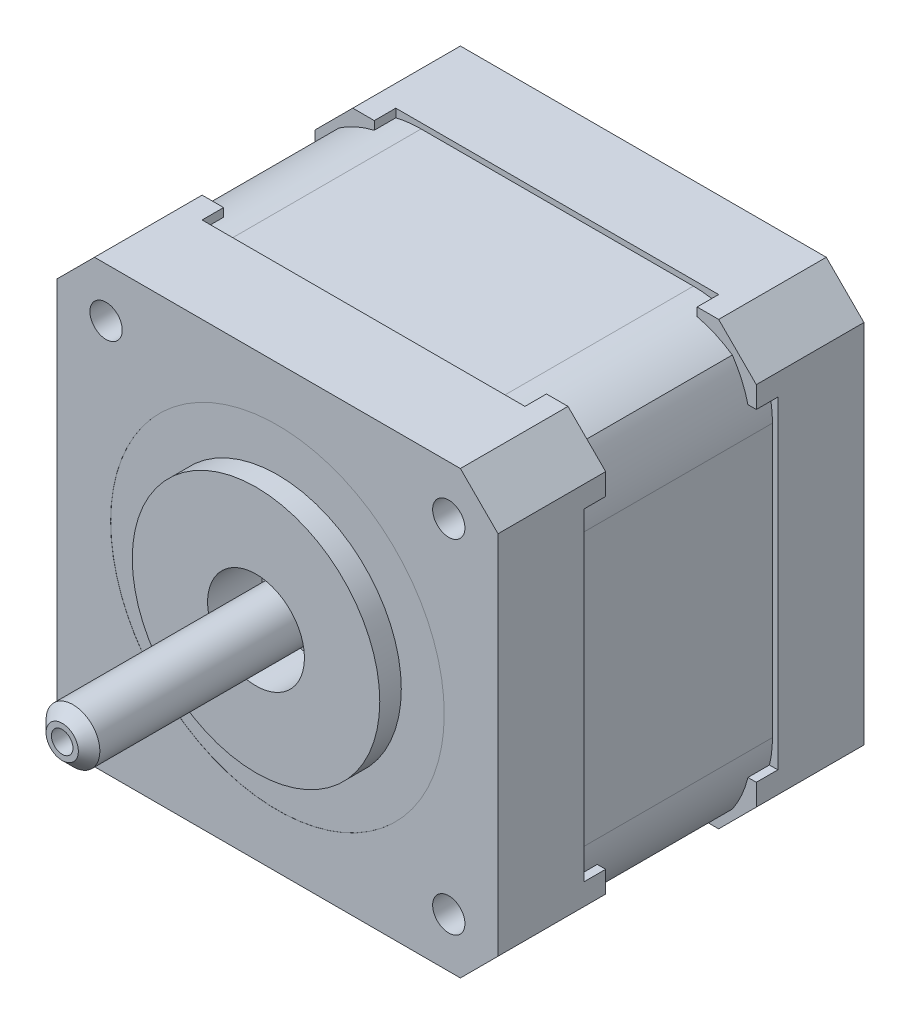
from build123d import *

# Parameters (mm, degrees)
Y_KSEKLIK_EKSTR_ZYON2_DEPTH  = 8
Y_KSEKLIK_EKSTR_ZYON10_DEPTH = 2
Y_KSEKLIK_EKSTR_ZYON11_DEPTH = 18
Y_KSEKLIK_EKSTR_ZYON12_DEPTH = 8
Y_KSEKLIK_EKSTR_ZYON14_DEPTH = 2
RADYUS5_R                    = 10
IZIM15_R                     = 4.5
KES_EKSTR_ZYON3_DEPTH        = 3
RADYUS6_R                    = 0.5
IZIM16_R                     = 3
Y_KSEKLIK_EKSTR_ZYON15_DEPTH = 1
RADYUS7_R                    = 0.5
KES_EKSTR_ZYON4_DEPTH        = 0.5
IZIM18_R                     = 3
KES_EKSTR_ZYON5_DEPTH        = 1
IZIM19_R                     = 2
Y_KSEKLIK_EKSTR_ZYON17_DEPTH = 0.5
RADYUS8_R                    = 0.5
KES_EKSTR_ZYON6_DEPTH        = 0.1
KES_EKSTR_ZYON7_START        = -3
IZIM22_R                     = 4.5
KES_EKSTR_ZYON7_DEPTH        = 3
IZIM23_R                     = 2.5
Y_KSEKLIK_EKSTR_ZYON18_DEPTH = 23
IZIM24_R                     = 1
KES_EKSTR_ZYON8_DEPTH        = 2
PAH1_SIZE                    = 1
KES_EKSTR_ZYON9_START        = -0.01
IZIM25_R                     = 15.5
IZIM25_R_2                   = 4.5
KES_EKSTR_ZYON9_DEPTH        = 0.01
IZIM26_R                     = 11.5
IZIM26_R_2                   = 4.5
Y_KSEKLIK_EKSTR_ZYON19_DEPTH = 2
IZIM28_R                     = 1.5
KES_EKSTR_ZYON10_DEPTH       = 6


# Some blends are built 0.0001 mm under size
with BuildPart() as part:
    # Çizim1 → Yükseklik-Ekstrüzyon2 (new body)
    with BuildSketch(Plane.XY):
        Polygon((-17, 41), (17, 41), (20.5, 37.5), (20.5, 3.5), (17, 0), (-17, 0), (-20.5, 3.5), (-20.5, 37.5), align=None)
    extrude(amount=Y_KSEKLIK_EKSTR_ZYON2_DEPTH)

    # Çizim5 → Yükseklik-Ekstrüzyon10 (add)
    with BuildSketch(Plane(origin=(0, 0, 0), x_dir=(-1, 0, 0), z_dir=(0, 0, -1))):
        Polygon((-20.5, 37.5), (-20.5, 35.5), (-20, 35.5), (-20, 37.292893219), (-16.792893219, 40.5), (-15, 40.5), (-15, 41), (-17, 41), align=None)
        Polygon((17, 41), (15, 41), (15, 40.5), (16.792893219, 40.5), (20, 37.292893219), (20, 35.5), (20.5, 35.5), (20.5, 37.5), align=None)
        Polygon((15, 0.5), (15, 0), (17, 0), (20.5, 3.5), (20.5, 5.5), (20, 5.5), (20, 3.707106781), (16.792893219, 0.5), align=None)
        Polygon((-20.5, 5.5), (-20.5, 3.5), (-17, 0), (-15, 0), (-15, 0.5), (-16.792893219, 0.5), (-20, 3.707106781), (-20, 5.5), align=None)
    extrude(amount=Y_KSEKLIK_EKSTR_ZYON10_DEPTH)

    # Çizim12 → Yükseklik-Ekstrüzyon11 (add)
    with BuildSketch(Plane(origin=(0, 0, 0), x_dir=(-1, 0, 0), z_dir=(0, 0, -1))):
        Polygon((-20, 37.292893219), (-20, 35.5), (-20, 5.5), (-20, 3.707106781), (-16.792893219, 0.5), (-15, 0.5), (15, 0.5), (16.792893219, 0.5), (20, 3.707106781), (20, 5.5), (20, 35.5), (20, 37.292893219), (16.792893219, 40.5), (15, 40.5), (-15, 40.5), (-16.792893219, 40.5), align=None)
    extrude(amount=Y_KSEKLIK_EKSTR_ZYON11_DEPTH)

    # Çizim13 → Yükseklik-Ekstrüzyon12 (add)
    with BuildSketch(Plane(origin=(0, 0, -18), x_dir=(-1, 0, 0), z_dir=(0, 0, -1))):
        Polygon((-17, 41), (-20.5, 37.5), (-20.5, 3.5), (-17, 0), (17, 0), (20.5, 3.5), (20.5, 37.5), (17, 41), align=None)
    extrude(amount=Y_KSEKLIK_EKSTR_ZYON12_DEPTH)

    # Çizim14 → Yükseklik-Ekstrüzyon14 (add)
    with BuildSketch(Plane.XY.offset(-18)):
        Polygon((-15, 40.5), (-15, 41), (-17, 41), (-20.5, 37.5), (-20.5, 35.5), (-20, 35.5), (-20, 37.292893219), (-16.792893219, 40.5), align=None)
        Polygon((-20, 5.5), (-20.5, 5.5), (-20.5, 3.5), (-17, 0), (-15, 0), (-15, 0.5), (-16.792893219, 0.5), (-20, 3.707106781), align=None)
        Polygon((20.5, 3.5), (20.5, 5.5), (20, 5.5), (20, 3.707106781), (16.792893219, 0.5), (15, 0.5), (15, 0), (17, 0), align=None)
        Polygon((20.5, 37.5), (17, 41), (15, 41), (15, 40.5), (16.792893219, 40.5), (20, 37.292893219), (20, 35.5), (20.5, 35.5), align=None)
    extrude(amount=Y_KSEKLIK_EKSTR_ZYON14_DEPTH)

    # Radyus5
    # the kernel refuses this fillet: 10 mm, written as the material it takes off along each edge
    with BuildSketch(Plane(origin=(-20, 3.707106781, 8.355339059), x_dir=(0, 1, 0), z_dir=(0, 0, -1))) as radyus5_piece_1_section:
        with BuildLine():
            CenterArc((RADYUS5_R * 0.414213562373, RADYUS5_R), RADYUS5_R, 225, 45)
            Line((-RADYUS5_R * 0.292893218813, RADYUS5_R * 0.292893218813), (0, 0))
            Line((0, 0), (RADYUS5_R * 0.414213562373, 0))
        make_face()
    radyus5_piece_1 = extrude(amount=24.355339059, mode=Mode.PRIVATE)
    radyus5_piece_1 = split(radyus5_piece_1, bisect_by=Plane(origin=(-20.041778626, 6.488010165, -2), z_dir=(0, 0, 1)), keep=Keep.TOP, mode=Mode.PRIVATE)
    radyus5_piece_1 = split(radyus5_piece_1, bisect_by=Plane(origin=(-20.041778626, 5.5, -1), z_dir=(0, 1, 0)), keep=Keep.TOP, mode=Mode.PRIVATE)
    radyus5_piece_1 = split(radyus5_piece_1, bisect_by=Plane(origin=(-20.041778626, 6.488010165, 0), z_dir=(0, 0, -1)), keep=Keep.TOP, mode=Mode.PRIVATE)
    add(radyus5_piece_1, mode=Mode.SUBTRACT)
    with BuildSketch(Plane(origin=(-20, 3.707106781, -2), x_dir=(0, 1, 0), z_dir=(0, 0, -1))) as radyus5_piece_2_section:
        with BuildLine():
            CenterArc((RADYUS5_R * 0.414213562373, RADYUS5_R), RADYUS5_R, 225, 45)
            Line((-RADYUS5_R * 0.292893218813, RADYUS5_R * 0.292893218813), (0, 0))
            Line((0, 0), (RADYUS5_R * 0.414213562373, 0))
        make_face()
    radyus5_piece_2 = extrude(amount=14, mode=Mode.PRIVATE)
    radyus5_piece_2 = split(radyus5_piece_2, bisect_by=Plane(origin=(-20.041778626, 5.5, -9), z_dir=(0, 1, 0)), keep=Keep.TOP, mode=Mode.PRIVATE)
    add(radyus5_piece_2, mode=Mode.SUBTRACT)
    with BuildSketch(Plane(origin=(-20, 3.707106781, -2), x_dir=(0, 1, 0), z_dir=(0, 0, -1))) as radyus5_piece_3_section:
        with BuildLine():
            CenterArc((RADYUS5_R * 0.414213562373, RADYUS5_R), RADYUS5_R, 225, 45)
            Line((-RADYUS5_R * 0.292893218813, RADYUS5_R * 0.292893218813), (0, 0))
            Line((0, 0), (RADYUS5_R * 0.414213562373, 0))
        make_face()
    radyus5_piece_3 = extrude(amount=14, mode=Mode.PRIVATE)
    radyus5_piece_3 = split(radyus5_piece_3, bisect_by=Plane(origin=(-19.237230112, 5.5, -9), z_dir=(0, -1, 0)), keep=Keep.TOP, mode=Mode.PRIVATE)
    add(radyus5_piece_3, mode=Mode.SUBTRACT)
    with BuildSketch(Plane(origin=(-20, 3.707106781, -2), x_dir=(0, 1, 0), z_dir=(0, 0, -1))) as radyus5_piece_4_section:
        with BuildLine():
            CenterArc((RADYUS5_R * 0.414213562373, RADYUS5_R), RADYUS5_R, 225, 45)
            Line((-RADYUS5_R * 0.292893218813, RADYUS5_R * 0.292893218813), (0, 0))
            Line((0, 0), (RADYUS5_R * 0.414213562373, 0))
        make_face()
    radyus5_piece_4 = extrude(amount=24.355339059, mode=Mode.PRIVATE)
    radyus5_piece_4 = split(radyus5_piece_4, bisect_by=Plane(origin=(-20.041778626, 6.488010165, -16), z_dir=(0, 0, -1)), keep=Keep.TOP, mode=Mode.PRIVATE)
    radyus5_piece_4 = split(radyus5_piece_4, bisect_by=Plane(origin=(-20.041778626, 6.488010165, -18), z_dir=(0, 0, 1)), keep=Keep.TOP, mode=Mode.PRIVATE)
    radyus5_piece_4 = split(radyus5_piece_4, bisect_by=Plane(origin=(-20.041778626, 5.5, -17), z_dir=(0, 1, 0)), keep=Keep.TOP, mode=Mode.PRIVATE)
    add(radyus5_piece_4, mode=Mode.SUBTRACT)
    with BuildSketch(Plane(origin=(-16.792893219, 0.5, 8.355339059), x_dir=(-0.7071067811865476, 0.7071067811865476, 0), z_dir=(0, 0, -1))) as radyus5_piece_5_section:
        with BuildLine():
            CenterArc((RADYUS5_R * 0.414213562373, RADYUS5_R), RADYUS5_R, 225, 45)
            Line((-RADYUS5_R * 0.292893218813, RADYUS5_R * 0.292893218813), (0, 0))
            Line((0, 0), (RADYUS5_R * 0.414213562373, 0))
        make_face()
    radyus5_piece_5 = extrude(amount=24.355339059, mode=Mode.PRIVATE)
    radyus5_piece_5 = split(radyus5_piece_5, bisect_by=Plane(origin=(-15, 0.458221374, -1), z_dir=(1, 0, 0)), keep=Keep.TOP, mode=Mode.PRIVATE)
    radyus5_piece_5 = split(radyus5_piece_5, bisect_by=Plane(origin=(-14.011989835, 0.458221374, -2), z_dir=(0, 0, 1)), keep=Keep.TOP, mode=Mode.PRIVATE)
    radyus5_piece_5 = split(radyus5_piece_5, bisect_by=Plane(origin=(-14.011989835, 0.458221374, 0), z_dir=(0, 0, -1)), keep=Keep.TOP, mode=Mode.PRIVATE)
    add(radyus5_piece_5, mode=Mode.SUBTRACT)
    with BuildSketch(Plane(origin=(-16.792893219, 0.5, -2), x_dir=(-0.7071067811865476, 0.7071067811865476, 0), z_dir=(0, 0, -1))) as radyus5_piece_6_section:
        with BuildLine():
            CenterArc((RADYUS5_R * 0.414213562373, RADYUS5_R), RADYUS5_R, 225, 45)
            Line((-RADYUS5_R * 0.292893218813, RADYUS5_R * 0.292893218813), (0, 0))
            Line((0, 0), (RADYUS5_R * 0.414213562373, 0))
        make_face()
    radyus5_piece_6 = extrude(amount=14, mode=Mode.PRIVATE)
    radyus5_piece_6 = split(radyus5_piece_6, bisect_by=Plane(origin=(-15, 1.262769888, -9), z_dir=(-1, 0, 0)), keep=Keep.TOP, mode=Mode.PRIVATE)
    add(radyus5_piece_6, mode=Mode.SUBTRACT)
    with BuildSketch(Plane(origin=(-16.792893219, 0.5, -2), x_dir=(-0.7071067811865476, 0.7071067811865476, 0), z_dir=(0, 0, -1))) as radyus5_piece_7_section:
        with BuildLine():
            CenterArc((RADYUS5_R * 0.414213562373, RADYUS5_R), RADYUS5_R, 225, 45)
            Line((-RADYUS5_R * 0.292893218813, RADYUS5_R * 0.292893218813), (0, 0))
            Line((0, 0), (RADYUS5_R * 0.414213562373, 0))
        make_face()
    radyus5_piece_7 = extrude(amount=14, mode=Mode.PRIVATE)
    radyus5_piece_7 = split(radyus5_piece_7, bisect_by=Plane(origin=(-15, 0.458221374, -9), z_dir=(1, 0, 0)), keep=Keep.TOP, mode=Mode.PRIVATE)
    add(radyus5_piece_7, mode=Mode.SUBTRACT)
    with BuildSketch(Plane(origin=(-16.792893219, 0.5, -2), x_dir=(-0.7071067811865476, 0.7071067811865476, 0), z_dir=(0, 0, -1))) as radyus5_piece_8_section:
        with BuildLine():
            CenterArc((RADYUS5_R * 0.414213562373, RADYUS5_R), RADYUS5_R, 225, 45)
            Line((-RADYUS5_R * 0.292893218813, RADYUS5_R * 0.292893218813), (0, 0))
            Line((0, 0), (RADYUS5_R * 0.414213562373, 0))
        make_face()
    radyus5_piece_8 = extrude(amount=24.355339059, mode=Mode.PRIVATE)
    radyus5_piece_8 = split(radyus5_piece_8, bisect_by=Plane(origin=(-14.011989835, 0.458221374, -18), z_dir=(0, 0, 1)), keep=Keep.TOP, mode=Mode.PRIVATE)
    radyus5_piece_8 = split(radyus5_piece_8, bisect_by=Plane(origin=(-15, 0.458221374, -17), z_dir=(1, 0, 0)), keep=Keep.TOP, mode=Mode.PRIVATE)
    radyus5_piece_8 = split(radyus5_piece_8, bisect_by=Plane(origin=(-14.011989835, 0.458221374, -16), z_dir=(0, 0, -1)), keep=Keep.TOP, mode=Mode.PRIVATE)
    add(radyus5_piece_8, mode=Mode.SUBTRACT)
    with BuildSketch(Plane(origin=(-16.792893219, 40.5, 8.355339059), x_dir=(-0.7071067811865476, -0.7071067811865476, 0), z_dir=(0, 0, -1))) as radyus5_piece_9_section:
        with BuildLine():
            CenterArc((RADYUS5_R * 0.414213562373, -RADYUS5_R), RADYUS5_R, 90, 45)
            Line((-RADYUS5_R * 0.292893218813, -RADYUS5_R * 0.292893218813), (0, 0))
            Line((0, 0), (RADYUS5_R * 0.414213562373, 0))
        make_face()
    radyus5_piece_9 = extrude(amount=24.355339059, mode=Mode.PRIVATE)
    radyus5_piece_9 = split(radyus5_piece_9, bisect_by=Plane(origin=(-14.011989835, 40.541778626, -2), z_dir=(0, 0, 1)), keep=Keep.TOP, mode=Mode.PRIVATE)
    radyus5_piece_9 = split(radyus5_piece_9, bisect_by=Plane(origin=(-14.011989835, 40.541778626, 0), z_dir=(0, 0, -1)), keep=Keep.TOP, mode=Mode.PRIVATE)
    radyus5_piece_9 = split(radyus5_piece_9, bisect_by=Plane(origin=(-15, 40.541778626, -1), z_dir=(1, 0, 0)), keep=Keep.TOP, mode=Mode.PRIVATE)
    add(radyus5_piece_9, mode=Mode.SUBTRACT)
    with BuildSketch(Plane(origin=(-16.792893219, 40.5, -2), x_dir=(-0.7071067811865476, -0.7071067811865476, 0), z_dir=(0, 0, -1))) as radyus5_piece_10_section:
        with BuildLine():
            CenterArc((RADYUS5_R * 0.414213562373, -RADYUS5_R), RADYUS5_R, 90, 45)
            Line((-RADYUS5_R * 0.292893218813, -RADYUS5_R * 0.292893218813), (0, 0))
            Line((0, 0), (RADYUS5_R * 0.414213562373, 0))
        make_face()
    radyus5_piece_10 = extrude(amount=14, mode=Mode.PRIVATE)
    radyus5_piece_10 = split(radyus5_piece_10, bisect_by=Plane(origin=(-15, 39.737230112, -9), z_dir=(-1, 0, 0)), keep=Keep.TOP, mode=Mode.PRIVATE)
    add(radyus5_piece_10, mode=Mode.SUBTRACT)
    with BuildSketch(Plane(origin=(-16.792893219, 40.5, -2), x_dir=(-0.7071067811865476, -0.7071067811865476, 0), z_dir=(0, 0, -1))) as radyus5_piece_11_section:
        with BuildLine():
            CenterArc((RADYUS5_R * 0.414213562373, -RADYUS5_R), RADYUS5_R, 90, 45)
            Line((-RADYUS5_R * 0.292893218813, -RADYUS5_R * 0.292893218813), (0, 0))
            Line((0, 0), (RADYUS5_R * 0.414213562373, 0))
        make_face()
    radyus5_piece_11 = extrude(amount=14, mode=Mode.PRIVATE)
    radyus5_piece_11 = split(radyus5_piece_11, bisect_by=Plane(origin=(-15, 40.541778626, -9), z_dir=(1, 0, 0)), keep=Keep.TOP, mode=Mode.PRIVATE)
    add(radyus5_piece_11, mode=Mode.SUBTRACT)
    with BuildSketch(Plane(origin=(-16.792893219, 40.5, -2), x_dir=(-0.7071067811865476, -0.7071067811865476, 0), z_dir=(0, 0, -1))) as radyus5_piece_12_section:
        with BuildLine():
            CenterArc((RADYUS5_R * 0.414213562373, -RADYUS5_R), RADYUS5_R, 90, 45)
            Line((-RADYUS5_R * 0.292893218813, -RADYUS5_R * 0.292893218813), (0, 0))
            Line((0, 0), (RADYUS5_R * 0.414213562373, 0))
        make_face()
    radyus5_piece_12 = extrude(amount=24.355339059, mode=Mode.PRIVATE)
    radyus5_piece_12 = split(radyus5_piece_12, bisect_by=Plane(origin=(-14.011989835, 40.541778626, -16), z_dir=(0, 0, -1)), keep=Keep.TOP, mode=Mode.PRIVATE)
    radyus5_piece_12 = split(radyus5_piece_12, bisect_by=Plane(origin=(-15, 40.541778626, -17), z_dir=(1, 0, 0)), keep=Keep.TOP, mode=Mode.PRIVATE)
    radyus5_piece_12 = split(radyus5_piece_12, bisect_by=Plane(origin=(-14.011989835, 40.541778626, -18), z_dir=(0, 0, 1)), keep=Keep.TOP, mode=Mode.PRIVATE)
    add(radyus5_piece_12, mode=Mode.SUBTRACT)
    with BuildSketch(Plane(origin=(-20, 37.292893219, 8.355339059), x_dir=(0.7071067811865476, 0.7071067811865476, 0), z_dir=(0, 0, -1))) as radyus5_piece_13_section:
        with BuildLine():
            CenterArc((RADYUS5_R * 0.414213562373, RADYUS5_R), RADYUS5_R, 225, 45)
            Line((-RADYUS5_R * 0.292893218813, RADYUS5_R * 0.292893218813), (0, 0))
            Line((0, 0), (RADYUS5_R * 0.414213562373, 0))
        make_face()
    radyus5_piece_13 = extrude(amount=24.355339059, mode=Mode.PRIVATE)
    radyus5_piece_13 = split(radyus5_piece_13, bisect_by=Plane(origin=(-20.041778626, 35.5, -1), z_dir=(0, -1, 0)), keep=Keep.TOP, mode=Mode.PRIVATE)
    radyus5_piece_13 = split(radyus5_piece_13, bisect_by=Plane(origin=(-20.041778626, 34.511989835, -2), z_dir=(0, 0, 1)), keep=Keep.TOP, mode=Mode.PRIVATE)
    radyus5_piece_13 = split(radyus5_piece_13, bisect_by=Plane(origin=(-20.041778626, 34.511989835, 0), z_dir=(0, 0, -1)), keep=Keep.TOP, mode=Mode.PRIVATE)
    add(radyus5_piece_13, mode=Mode.SUBTRACT)
    with BuildSketch(Plane(origin=(-20, 37.292893219, -2), x_dir=(0.7071067811865476, 0.7071067811865476, 0), z_dir=(0, 0, -1))) as radyus5_piece_14_section:
        with BuildLine():
            CenterArc((RADYUS5_R * 0.414213562373, RADYUS5_R), RADYUS5_R, 225, 45)
            Line((-RADYUS5_R * 0.292893218813, RADYUS5_R * 0.292893218813), (0, 0))
            Line((0, 0), (RADYUS5_R * 0.414213562373, 0))
        make_face()
    radyus5_piece_14 = extrude(amount=14, mode=Mode.PRIVATE)
    radyus5_piece_14 = split(radyus5_piece_14, bisect_by=Plane(origin=(-19.237230112, 35.5, -9), z_dir=(0, 1, 0)), keep=Keep.TOP, mode=Mode.PRIVATE)
    add(radyus5_piece_14, mode=Mode.SUBTRACT)
    with BuildSketch(Plane(origin=(-20, 37.292893219, -2), x_dir=(0.7071067811865476, 0.7071067811865476, 0), z_dir=(0, 0, -1))) as radyus5_piece_15_section:
        with BuildLine():
            CenterArc((RADYUS5_R * 0.414213562373, RADYUS5_R), RADYUS5_R, 225, 45)
            Line((-RADYUS5_R * 0.292893218813, RADYUS5_R * 0.292893218813), (0, 0))
            Line((0, 0), (RADYUS5_R * 0.414213562373, 0))
        make_face()
    radyus5_piece_15 = extrude(amount=14, mode=Mode.PRIVATE)
    radyus5_piece_15 = split(radyus5_piece_15, bisect_by=Plane(origin=(-20.041778626, 35.5, -9), z_dir=(0, -1, 0)), keep=Keep.TOP, mode=Mode.PRIVATE)
    add(radyus5_piece_15, mode=Mode.SUBTRACT)
    with BuildSketch(Plane(origin=(-20, 37.292893219, -2), x_dir=(0.7071067811865476, 0.7071067811865476, 0), z_dir=(0, 0, -1))) as radyus5_piece_16_section:
        with BuildLine():
            CenterArc((RADYUS5_R * 0.414213562373, RADYUS5_R), RADYUS5_R, 225, 45)
            Line((-RADYUS5_R * 0.292893218813, RADYUS5_R * 0.292893218813), (0, 0))
            Line((0, 0), (RADYUS5_R * 0.414213562373, 0))
        make_face()
    radyus5_piece_16 = extrude(amount=24.355339059, mode=Mode.PRIVATE)
    radyus5_piece_16 = split(radyus5_piece_16, bisect_by=Plane(origin=(-20.041778626, 34.511989835, -18), z_dir=(0, 0, 1)), keep=Keep.TOP, mode=Mode.PRIVATE)
    radyus5_piece_16 = split(radyus5_piece_16, bisect_by=Plane(origin=(-20.041778626, 35.5, -17), z_dir=(0, -1, 0)), keep=Keep.TOP, mode=Mode.PRIVATE)
    radyus5_piece_16 = split(radyus5_piece_16, bisect_by=Plane(origin=(-20.041778626, 34.511989835, -16), z_dir=(0, 0, -1)), keep=Keep.TOP, mode=Mode.PRIVATE)
    add(radyus5_piece_16, mode=Mode.SUBTRACT)
    with BuildSketch(Plane(origin=(20, 37.292893219, 8.355339059), x_dir=(0, -1, 0), z_dir=(0, 0, -1))) as radyus5_piece_17_section:
        with BuildLine():
            CenterArc((RADYUS5_R * 0.414213562373, RADYUS5_R), RADYUS5_R, 225, 45)
            Line((-RADYUS5_R * 0.292893218813, RADYUS5_R * 0.292893218813), (0, 0))
            Line((0, 0), (RADYUS5_R * 0.414213562373, 0))
        make_face()
    radyus5_piece_17 = extrude(amount=24.355339059, mode=Mode.PRIVATE)
    radyus5_piece_17 = split(radyus5_piece_17, bisect_by=Plane(origin=(20.041778626, 35.5, -1), z_dir=(0, -1, 0)), keep=Keep.TOP, mode=Mode.PRIVATE)
    radyus5_piece_17 = split(radyus5_piece_17, bisect_by=Plane(origin=(20.041778626, 34.511989835, 0), z_dir=(0, 0, -1)), keep=Keep.TOP, mode=Mode.PRIVATE)
    radyus5_piece_17 = split(radyus5_piece_17, bisect_by=Plane(origin=(20.041778626, 34.511989835, -2), z_dir=(0, 0, 1)), keep=Keep.TOP, mode=Mode.PRIVATE)
    add(radyus5_piece_17, mode=Mode.SUBTRACT)
    with BuildSketch(Plane(origin=(20, 37.292893219, -2), x_dir=(0, -1, 0), z_dir=(0, 0, -1))) as radyus5_piece_18_section:
        with BuildLine():
            CenterArc((RADYUS5_R * 0.414213562373, RADYUS5_R), RADYUS5_R, 225, 45)
            Line((-RADYUS5_R * 0.292893218813, RADYUS5_R * 0.292893218813), (0, 0))
            Line((0, 0), (RADYUS5_R * 0.414213562373, 0))
        make_face()
    radyus5_piece_18 = extrude(amount=14, mode=Mode.PRIVATE)
    radyus5_piece_18 = split(radyus5_piece_18, bisect_by=Plane(origin=(20.041778626, 35.5, -9), z_dir=(0, -1, 0)), keep=Keep.TOP, mode=Mode.PRIVATE)
    add(radyus5_piece_18, mode=Mode.SUBTRACT)
    with BuildSketch(Plane(origin=(20, 37.292893219, -2), x_dir=(0, -1, 0), z_dir=(0, 0, -1))) as radyus5_piece_19_section:
        with BuildLine():
            CenterArc((RADYUS5_R * 0.414213562373, RADYUS5_R), RADYUS5_R, 225, 45)
            Line((-RADYUS5_R * 0.292893218813, RADYUS5_R * 0.292893218813), (0, 0))
            Line((0, 0), (RADYUS5_R * 0.414213562373, 0))
        make_face()
    radyus5_piece_19 = extrude(amount=14, mode=Mode.PRIVATE)
    radyus5_piece_19 = split(radyus5_piece_19, bisect_by=Plane(origin=(19.237230112, 35.5, -9), z_dir=(0, 1, 0)), keep=Keep.TOP, mode=Mode.PRIVATE)
    add(radyus5_piece_19, mode=Mode.SUBTRACT)
    with BuildSketch(Plane(origin=(20, 37.292893219, -2), x_dir=(0, -1, 0), z_dir=(0, 0, -1))) as radyus5_piece_20_section:
        with BuildLine():
            CenterArc((RADYUS5_R * 0.414213562373, RADYUS5_R), RADYUS5_R, 225, 45)
            Line((-RADYUS5_R * 0.292893218813, RADYUS5_R * 0.292893218813), (0, 0))
            Line((0, 0), (RADYUS5_R * 0.414213562373, 0))
        make_face()
    radyus5_piece_20 = extrude(amount=24.355339059, mode=Mode.PRIVATE)
    radyus5_piece_20 = split(radyus5_piece_20, bisect_by=Plane(origin=(20.041778626, 34.511989835, -16), z_dir=(0, 0, -1)), keep=Keep.TOP, mode=Mode.PRIVATE)
    radyus5_piece_20 = split(radyus5_piece_20, bisect_by=Plane(origin=(20.041778626, 35.5, -17), z_dir=(0, -1, 0)), keep=Keep.TOP, mode=Mode.PRIVATE)
    radyus5_piece_20 = split(radyus5_piece_20, bisect_by=Plane(origin=(20.041778626, 34.511989835, -18), z_dir=(0, 0, 1)), keep=Keep.TOP, mode=Mode.PRIVATE)
    add(radyus5_piece_20, mode=Mode.SUBTRACT)
    with BuildSketch(Plane(origin=(16.792893219, 40.5, 8.355339059), x_dir=(0.7071067811865485, -0.7071067811865467, 0), z_dir=(0, 0, -1))) as radyus5_piece_21_section:
        with BuildLine():
            CenterArc((RADYUS5_R * 0.414213562373, RADYUS5_R), RADYUS5_R, 225, 45)
            Line((-RADYUS5_R * 0.292893218813, RADYUS5_R * 0.292893218813), (0, 0))
            Line((0, 0), (RADYUS5_R * 0.414213562373, 0))
        make_face()
    radyus5_piece_21 = extrude(amount=24.355339059, mode=Mode.PRIVATE)
    radyus5_piece_21 = split(radyus5_piece_21, bisect_by=Plane(origin=(14.011989835, 40.541778626, -2), z_dir=(0, 0, 1)), keep=Keep.TOP, mode=Mode.PRIVATE)
    radyus5_piece_21 = split(radyus5_piece_21, bisect_by=Plane(origin=(15, 40.541778626, -1), z_dir=(-1, 0, 0)), keep=Keep.TOP, mode=Mode.PRIVATE)
    radyus5_piece_21 = split(radyus5_piece_21, bisect_by=Plane(origin=(14.011989835, 40.541778626, 0), z_dir=(0, 0, -1)), keep=Keep.TOP, mode=Mode.PRIVATE)
    add(radyus5_piece_21, mode=Mode.SUBTRACT)
    with BuildSketch(Plane(origin=(16.792893219, 40.5, -2), x_dir=(0.7071067811865485, -0.7071067811865467, 0), z_dir=(0, 0, -1))) as radyus5_piece_22_section:
        with BuildLine():
            CenterArc((RADYUS5_R * 0.414213562373, RADYUS5_R), RADYUS5_R, 225, 45)
            Line((-RADYUS5_R * 0.292893218813, RADYUS5_R * 0.292893218813), (0, 0))
            Line((0, 0), (RADYUS5_R * 0.414213562373, 0))
        make_face()
    radyus5_piece_22 = extrude(amount=14, mode=Mode.PRIVATE)
    radyus5_piece_22 = split(radyus5_piece_22, bisect_by=Plane(origin=(15, 39.737230112, -9), z_dir=(1, 0, 0)), keep=Keep.TOP, mode=Mode.PRIVATE)
    add(radyus5_piece_22, mode=Mode.SUBTRACT)
    with BuildSketch(Plane(origin=(16.792893219, 40.5, -2), x_dir=(0.7071067811865485, -0.7071067811865467, 0), z_dir=(0, 0, -1))) as radyus5_piece_23_section:
        with BuildLine():
            CenterArc((RADYUS5_R * 0.414213562373, RADYUS5_R), RADYUS5_R, 225, 45)
            Line((-RADYUS5_R * 0.292893218813, RADYUS5_R * 0.292893218813), (0, 0))
            Line((0, 0), (RADYUS5_R * 0.414213562373, 0))
        make_face()
    radyus5_piece_23 = extrude(amount=14, mode=Mode.PRIVATE)
    radyus5_piece_23 = split(radyus5_piece_23, bisect_by=Plane(origin=(15, 40.541778626, -9), z_dir=(-1, 0, 0)), keep=Keep.TOP, mode=Mode.PRIVATE)
    add(radyus5_piece_23, mode=Mode.SUBTRACT)
    with BuildSketch(Plane(origin=(16.792893219, 40.5, -2), x_dir=(0.7071067811865485, -0.7071067811865467, 0), z_dir=(0, 0, -1))) as radyus5_piece_24_section:
        with BuildLine():
            CenterArc((RADYUS5_R * 0.414213562373, RADYUS5_R), RADYUS5_R, 225, 45)
            Line((-RADYUS5_R * 0.292893218813, RADYUS5_R * 0.292893218813), (0, 0))
            Line((0, 0), (RADYUS5_R * 0.414213562373, 0))
        make_face()
    radyus5_piece_24 = extrude(amount=24.355339059, mode=Mode.PRIVATE)
    radyus5_piece_24 = split(radyus5_piece_24, bisect_by=Plane(origin=(14.011989835, 40.541778626, -16), z_dir=(0, 0, -1)), keep=Keep.TOP, mode=Mode.PRIVATE)
    radyus5_piece_24 = split(radyus5_piece_24, bisect_by=Plane(origin=(15, 40.541778626, -17), z_dir=(-1, 0, 0)), keep=Keep.TOP, mode=Mode.PRIVATE)
    radyus5_piece_24 = split(radyus5_piece_24, bisect_by=Plane(origin=(14.011989835, 40.541778626, -18), z_dir=(0, 0, 1)), keep=Keep.TOP, mode=Mode.PRIVATE)
    add(radyus5_piece_24, mode=Mode.SUBTRACT)
    with BuildSketch(Plane(origin=(20, 3.707106781, 8.355339059), x_dir=(-0.7071067811865475, -0.7071067811865478, 0), z_dir=(0, 0, -1))) as radyus5_piece_25_section:
        with BuildLine():
            CenterArc((RADYUS5_R * 0.414213562373, RADYUS5_R), RADYUS5_R, 225, 45)
            Line((-RADYUS5_R * 0.292893218813, RADYUS5_R * 0.292893218813), (0, 0))
            Line((0, 0), (RADYUS5_R * 0.414213562373, 0))
        make_face()
    radyus5_piece_25 = extrude(amount=24.355339059, mode=Mode.PRIVATE)
    radyus5_piece_25 = split(radyus5_piece_25, bisect_by=Plane(origin=(20.041778626, 5.5, -1), z_dir=(0, 1, 0)), keep=Keep.TOP, mode=Mode.PRIVATE)
    radyus5_piece_25 = split(radyus5_piece_25, bisect_by=Plane(origin=(20.041778626, 6.488010165, -2), z_dir=(0, 0, 1)), keep=Keep.TOP, mode=Mode.PRIVATE)
    radyus5_piece_25 = split(radyus5_piece_25, bisect_by=Plane(origin=(20.041778626, 6.488010165, 0), z_dir=(0, 0, -1)), keep=Keep.TOP, mode=Mode.PRIVATE)
    add(radyus5_piece_25, mode=Mode.SUBTRACT)
    with BuildSketch(Plane(origin=(20, 3.707106781, -2), x_dir=(-0.7071067811865475, -0.7071067811865478, 0), z_dir=(0, 0, -1))) as radyus5_piece_26_section:
        with BuildLine():
            CenterArc((RADYUS5_R * 0.414213562373, RADYUS5_R), RADYUS5_R, 225, 45)
            Line((-RADYUS5_R * 0.292893218813, RADYUS5_R * 0.292893218813), (0, 0))
            Line((0, 0), (RADYUS5_R * 0.414213562373, 0))
        make_face()
    radyus5_piece_26 = extrude(amount=14, mode=Mode.PRIVATE)
    radyus5_piece_26 = split(radyus5_piece_26, bisect_by=Plane(origin=(19.237230112, 5.5, -9), z_dir=(0, -1, 0)), keep=Keep.TOP, mode=Mode.PRIVATE)
    add(radyus5_piece_26, mode=Mode.SUBTRACT)
    with BuildSketch(Plane(origin=(20, 3.707106781, -2), x_dir=(-0.7071067811865475, -0.7071067811865478, 0), z_dir=(0, 0, -1))) as radyus5_piece_27_section:
        with BuildLine():
            CenterArc((RADYUS5_R * 0.414213562373, RADYUS5_R), RADYUS5_R, 225, 45)
            Line((-RADYUS5_R * 0.292893218813, RADYUS5_R * 0.292893218813), (0, 0))
            Line((0, 0), (RADYUS5_R * 0.414213562373, 0))
        make_face()
    radyus5_piece_27 = extrude(amount=14, mode=Mode.PRIVATE)
    radyus5_piece_27 = split(radyus5_piece_27, bisect_by=Plane(origin=(20.041778626, 5.5, -9), z_dir=(0, 1, 0)), keep=Keep.TOP, mode=Mode.PRIVATE)
    add(radyus5_piece_27, mode=Mode.SUBTRACT)
    with BuildSketch(Plane(origin=(20, 3.707106781, -2), x_dir=(-0.7071067811865475, -0.7071067811865478, 0), z_dir=(0, 0, -1))) as radyus5_piece_28_section:
        with BuildLine():
            CenterArc((RADYUS5_R * 0.414213562373, RADYUS5_R), RADYUS5_R, 225, 45)
            Line((-RADYUS5_R * 0.292893218813, RADYUS5_R * 0.292893218813), (0, 0))
            Line((0, 0), (RADYUS5_R * 0.414213562373, 0))
        make_face()
    radyus5_piece_28 = extrude(amount=24.355339059, mode=Mode.PRIVATE)
    radyus5_piece_28 = split(radyus5_piece_28, bisect_by=Plane(origin=(20.041778626, 6.488010165, -18), z_dir=(0, 0, 1)), keep=Keep.TOP, mode=Mode.PRIVATE)
    radyus5_piece_28 = split(radyus5_piece_28, bisect_by=Plane(origin=(20.041778626, 5.5, -17), z_dir=(0, 1, 0)), keep=Keep.TOP, mode=Mode.PRIVATE)
    radyus5_piece_28 = split(radyus5_piece_28, bisect_by=Plane(origin=(20.041778626, 6.488010165, -16), z_dir=(0, 0, -1)), keep=Keep.TOP, mode=Mode.PRIVATE)
    add(radyus5_piece_28, mode=Mode.SUBTRACT)
    with BuildSketch(Plane(origin=(16.792893219, 0.5, 8.355339059), x_dir=(-1, 0, 0), z_dir=(0, 0, -1))) as radyus5_piece_29_section:
        with BuildLine():
            CenterArc((RADYUS5_R * 0.414213562373, RADYUS5_R), RADYUS5_R, 225, 45)
            Line((-RADYUS5_R * 0.292893218813, RADYUS5_R * 0.292893218813), (0, 0))
            Line((0, 0), (RADYUS5_R * 0.414213562373, 0))
        make_face()
    radyus5_piece_29 = extrude(amount=24.355339059, mode=Mode.PRIVATE)
    radyus5_piece_29 = split(radyus5_piece_29, bisect_by=Plane(origin=(14.011989835, 0.458221374, 0), z_dir=(0, 0, -1)), keep=Keep.TOP, mode=Mode.PRIVATE)
    radyus5_piece_29 = split(radyus5_piece_29, bisect_by=Plane(origin=(15, 0.458221374, -1), z_dir=(-1, 0, 0)), keep=Keep.TOP, mode=Mode.PRIVATE)
    radyus5_piece_29 = split(radyus5_piece_29, bisect_by=Plane(origin=(14.011989835, 0.458221374, -2), z_dir=(0, 0, 1)), keep=Keep.TOP, mode=Mode.PRIVATE)
    add(radyus5_piece_29, mode=Mode.SUBTRACT)
    with BuildSketch(Plane(origin=(16.792893219, 0.5, -2), x_dir=(-1, 0, 0), z_dir=(0, 0, -1))) as radyus5_piece_30_section:
        with BuildLine():
            CenterArc((RADYUS5_R * 0.414213562373, RADYUS5_R), RADYUS5_R, 225, 45)
            Line((-RADYUS5_R * 0.292893218813, RADYUS5_R * 0.292893218813), (0, 0))
            Line((0, 0), (RADYUS5_R * 0.414213562373, 0))
        make_face()
    radyus5_piece_30 = extrude(amount=14, mode=Mode.PRIVATE)
    radyus5_piece_30 = split(radyus5_piece_30, bisect_by=Plane(origin=(15, 0.458221374, -9), z_dir=(-1, 0, 0)), keep=Keep.TOP, mode=Mode.PRIVATE)
    add(radyus5_piece_30, mode=Mode.SUBTRACT)
    with BuildSketch(Plane(origin=(16.792893219, 0.5, -2), x_dir=(-1, 0, 0), z_dir=(0, 0, -1))) as radyus5_piece_31_section:
        with BuildLine():
            CenterArc((RADYUS5_R * 0.414213562373, RADYUS5_R), RADYUS5_R, 225, 45)
            Line((-RADYUS5_R * 0.292893218813, RADYUS5_R * 0.292893218813), (0, 0))
            Line((0, 0), (RADYUS5_R * 0.414213562373, 0))
        make_face()
    radyus5_piece_31 = extrude(amount=14, mode=Mode.PRIVATE)
    radyus5_piece_31 = split(radyus5_piece_31, bisect_by=Plane(origin=(15, 1.262769888, -9), z_dir=(1, 0, 0)), keep=Keep.TOP, mode=Mode.PRIVATE)
    add(radyus5_piece_31, mode=Mode.SUBTRACT)
    with BuildSketch(Plane(origin=(16.792893219, 0.5, -2), x_dir=(-1, 0, 0), z_dir=(0, 0, -1))) as radyus5_piece_32_section:
        with BuildLine():
            CenterArc((RADYUS5_R * 0.414213562373, RADYUS5_R), RADYUS5_R, 225, 45)
            Line((-RADYUS5_R * 0.292893218813, RADYUS5_R * 0.292893218813), (0, 0))
            Line((0, 0), (RADYUS5_R * 0.414213562373, 0))
        make_face()
    radyus5_piece_32 = extrude(amount=24.355339059, mode=Mode.PRIVATE)
    radyus5_piece_32 = split(radyus5_piece_32, bisect_by=Plane(origin=(14.011989835, 0.458221374, -16), z_dir=(0, 0, -1)), keep=Keep.TOP, mode=Mode.PRIVATE)
    radyus5_piece_32 = split(radyus5_piece_32, bisect_by=Plane(origin=(14.011989835, 0.458221374, -18), z_dir=(0, 0, 1)), keep=Keep.TOP, mode=Mode.PRIVATE)
    radyus5_piece_32 = split(radyus5_piece_32, bisect_by=Plane(origin=(15, 0.458221374, -17), z_dir=(-1, 0, 0)), keep=Keep.TOP, mode=Mode.PRIVATE)
    add(radyus5_piece_32, mode=Mode.SUBTRACT)

    # Çizim15 → Kes-Ekstrüzyon3 (cut)
    with BuildSketch(Plane(origin=(0, 0, -26), x_dir=(-1, 0, 0), z_dir=(0, 0, -1))):
        with Locations((0, 20.5)):
            Circle(IZIM15_R)
    extrude(amount=-KES_EKSTR_ZYON3_DEPTH, mode=Mode.SUBTRACT)

    # Radyus6
    radyus6_edges = [part.edges().sort_by_distance(p)[0] for p in [
        (4.5, 20.5, -26),
    ]]
    fillet(radyus6_edges, radius=RADYUS6_R)

    # Çizim16 → Yükseklik-Ekstrüzyon15 (add)
    with BuildSketch(Plane(origin=(0, 0, -23), x_dir=(-1, 0, 0), z_dir=(0, 0, -1))):
        with Locations((0, 20.5)):
            Circle(IZIM16_R)
    extrude(amount=Y_KSEKLIK_EKSTR_ZYON15_DEPTH)

    # Radyus7
    radyus7_edges = [part.edges().sort_by_distance(p)[0] for p in [
        (3, 20.5, -24),
    ]]
    fillet(radyus7_edges, radius=RADYUS7_R)

    # Çizim17 → Kes-Ekstrüzyon4 (cut)
    with BuildSketch(Plane(origin=(0, 0, -24), x_dir=(-1, 0, 0), z_dir=(0, 0, -1))):
        Polygon((1.260310639, 19.796472867), (1.239427689, 21.239697464), (-0.02088295, 21.943224596), (-1.260310639, 21.203527133), (-1.239427689, 19.760302536), (0.02088295, 19.056775404), align=None)
    extrude(amount=-KES_EKSTR_ZYON4_DEPTH, mode=Mode.SUBTRACT)

    # Çizim18 → Kes-Ekstrüzyon5 (cut)
    with BuildSketch(Plane(origin=(0, 0, -26), x_dir=(-1, 0, 0), z_dir=(0, 0, -1))):
        with Locations((-15, 5.5)):
            Circle(IZIM18_R)
        with Locations((15, 35.5)):
            Circle(IZIM18_R)
        with Locations(Location((15, 5.5, 0), (0, 0, 180))):
            Circle(IZIM18_R)
        with Locations(Location((-15, 35.5, 0), (0, 0, 180))):
            Circle(IZIM18_R)
    extrude(amount=-KES_EKSTR_ZYON5_DEPTH, mode=Mode.SUBTRACT)

    # Çizim19 → Yükseklik-Ekstrüzyon17 (add)
    with BuildSketch(Plane(origin=(0, 0, -25), x_dir=(-1, 0, 0), z_dir=(0, 0, -1))):
        with Locations((15, 35.5)):
            Circle(IZIM19_R)
        with Locations(Location((15, 5.5, 0), (0, 0, 180))):
            Circle(IZIM19_R)
        with Locations((-15, 5.5)):
            Circle(IZIM19_R)
        with Locations(Location((-15, 35.5, 0), (0, 0, 180))):
            Circle(IZIM19_R)
    extrude(amount=Y_KSEKLIK_EKSTR_ZYON17_DEPTH)

    # Radyus8
    radyus8_edges = [part.edges().sort_by_distance(p)[0] for p in [
        (-13, 35.5, -25.5),
        (17, 5.5, -25.5),
        (-17, 5.5, -25.5),
        (13, 35.5, -25.5),
    ]]
    fillet(radyus8_edges, radius=RADYUS8_R - 0.0001)  # a hair under: the kernel refuses the full size

    # Çizim21 → Kes-Ekstrüzyon6 (cut)
    with BuildSketch(Plane(origin=(0, 0, -25.5), x_dir=(-1, 0, 0), z_dir=(0, 0, -1))):
        Polygon((15.15, 6.5), (14.85, 6.5), (14.85, 5.65), (14, 5.65), (14, 5.35), (14.85, 5.35), (14.85, 4.5), (15.15, 4.5), (15.15, 5.35), (16, 5.35), (16, 5.65), (15.15, 5.65), align=None)
        Polygon((15.15, 35.65), (15.15, 36.5), (14.85, 36.5), (14.85, 35.65), (14, 35.65), (14, 35.35), (14.85, 35.35), (14.85, 34.5), (15.15, 34.5), (15.15, 35.35), (16, 35.35), (16, 35.65), align=None)
        Polygon((-14, 35.35), (-14, 35.65), (-14.85, 35.65), (-14.85, 36.5), (-15.15, 36.5), (-15.15, 35.65), (-16, 35.65), (-16, 35.35), (-15.15, 35.35), (-15.15, 34.5), (-14.85, 34.5), (-14.85, 35.35), align=None)
        Polygon((-16, 5.35), (-16, 5.65), (-15.15, 5.65), (-15.15, 6.5), (-14.85, 6.5), (-14.85, 5.65), (-14, 5.65), (-14, 5.35), (-14.85, 5.35), (-14.85, 4.5), (-15.15, 4.5), (-15.15, 5.35), align=None)
    extrude(amount=-KES_EKSTR_ZYON6_DEPTH, mode=Mode.SUBTRACT)

    # Çizim22 → Kes-Ekstrüzyon7 (cut)
    with BuildSketch(Plane.XY.offset(8).offset(KES_EKSTR_ZYON7_START)):
        with Locations(Location((0, 20.5, 0), (0, 0, 180))):
            Circle(IZIM22_R)
    extrude(amount=KES_EKSTR_ZYON7_DEPTH, mode=Mode.SUBTRACT)

    # Çizim23 → Yükseklik-Ekstrüzyon18 (add)
    with BuildSketch(Plane.XY.offset(5)):
        with Locations((0, 20.5)):
            Circle(IZIM23_R)
    extrude(amount=Y_KSEKLIK_EKSTR_ZYON18_DEPTH)

    # Çizim24 → Kes-Ekstrüzyon8 (cut)
    with BuildSketch(Plane.XY.offset(28)):
        with Locations((0, 20.5)):
            Circle(IZIM24_R)
    extrude(amount=-KES_EKSTR_ZYON8_DEPTH, mode=Mode.SUBTRACT)

    # Pah1
    pah1_edges = [part.edges().sort_by_distance(p)[0] for p in [
        (-2.5, 20.5, 28),
    ]]
    chamfer(pah1_edges, length=PAH1_SIZE)

    # Çizim25 → Kes-Ekstrüzyon9 (cut)
    with BuildSketch(Plane.XY.offset(8).offset(KES_EKSTR_ZYON9_START)):
        with Locations((0, 20.5)):
            Circle(IZIM25_R)
        with Locations(Location((0, 20.5, 0), (0, 0, 180))):
            Circle(IZIM25_R_2, mode=Mode.SUBTRACT)
    extrude(amount=KES_EKSTR_ZYON9_DEPTH, mode=Mode.SUBTRACT)

    # Çizim26 → Yükseklik-Ekstrüzyon19 (add)
    with BuildSketch(Plane.XY.offset(7.99)):
        with Locations((0, 20.5)):
            Circle(IZIM26_R)
        with Locations(Location((0, 20.5, 0), (0, 0, 180))):
            Circle(IZIM26_R_2, mode=Mode.SUBTRACT)
    extrude(amount=Y_KSEKLIK_EKSTR_ZYON19_DEPTH)

    # Çizim28 → Kes-Ekstrüzyon10 (cut)
    with BuildSketch(Plane.XY.offset(8)):
        with Locations((15.921572875, 36.421572875)):
            Circle(IZIM28_R)
        with Locations((-15.921572875, 36.421572875)):
            Circle(IZIM28_R)
        with Locations((15.921572875, 4.578427125)):
            Circle(IZIM28_R)
        with Locations((-15.921572875, 4.578427125)):
            Circle(IZIM28_R)
    extrude(amount=-KES_EKSTR_ZYON10_DEPTH, mode=Mode.SUBTRACT)


solid = part.part
